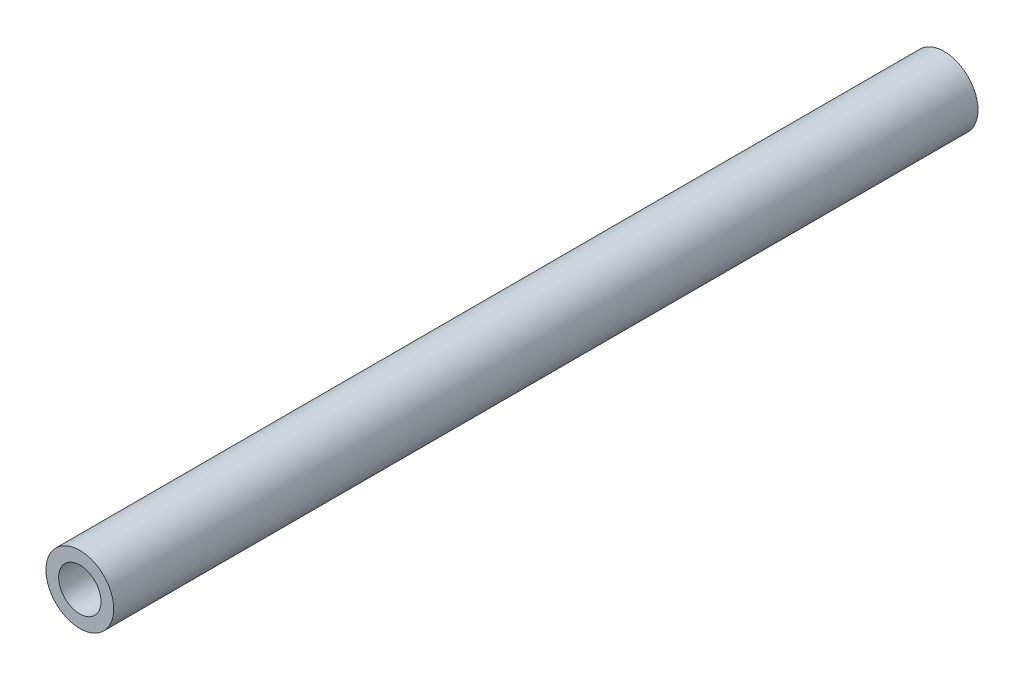
from build123d import *

# Parameters (mm, degrees)
SZKIC1_R                    = 8
SZKIC1_R_2                  = 4
DODANIE_WYCI_GNI_CIE1_DEPTH = 102
SZKIC2_R                    = 5
WYTNIJ_WYCI_GNI_CIE1_DEPTH  = 40
WYTNIJ_WYCI_GNI_CIE2_START  = -30
SZKIC3_R                    = 5
WYTNIJ_WYCI_GNI_CIE2_DEPTH  = 30


with BuildPart() as part:
    # Szkic1 → Dodanie-wyciągnięcie1 (new, symmetric)
    with BuildSketch(Plane.XY):
        Circle(SZKIC1_R)
        Circle(SZKIC1_R_2, mode=Mode.SUBTRACT)
    extrude(amount=DODANIE_WYCI_GNI_CIE1_DEPTH, both=True)

    # Szkic2 → Wytnij-wyciągnięcie1 (cut)
    with BuildSketch(Plane.XY.offset(102)):
        Circle(SZKIC2_R)
    extrude(amount=-WYTNIJ_WYCI_GNI_CIE1_DEPTH, mode=Mode.SUBTRACT)

    # Szkic3 → Wytnij-wyciągnięcie2 (cut)
    with BuildSketch(Plane(origin=(0, 0, -102), x_dir=(-1, 0, 0), z_dir=(0, 0, -1)).offset(WYTNIJ_WYCI_GNI_CIE2_START)):
        Circle(SZKIC3_R)
    extrude(amount=WYTNIJ_WYCI_GNI_CIE2_DEPTH, mode=Mode.SUBTRACT)


solid = part.part
